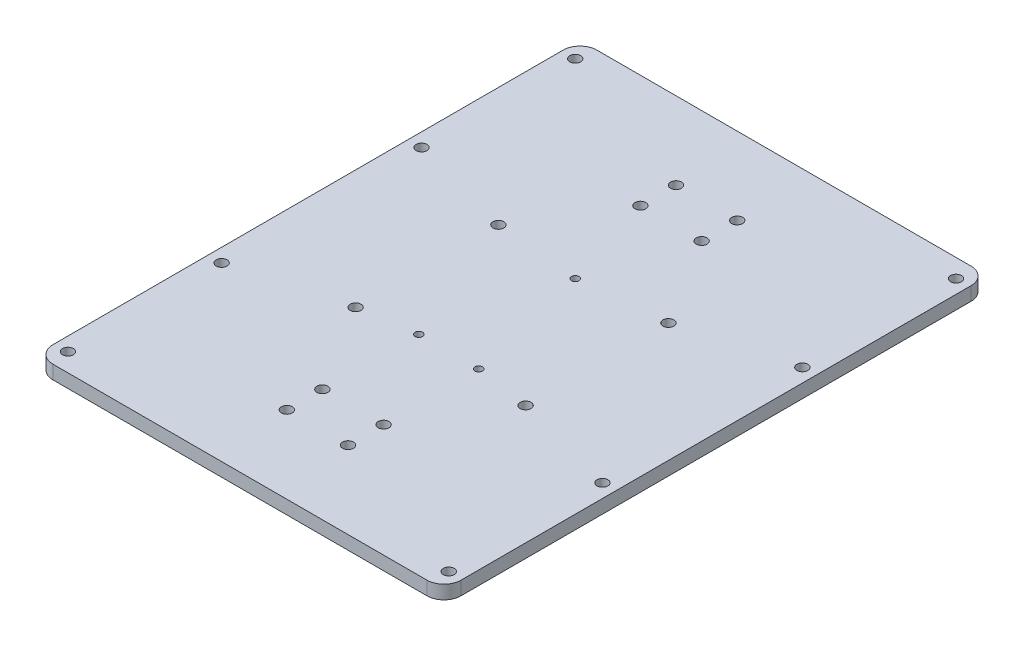
from build123d import *

# Parameters (mm, degrees)
SKETCH_1_W      = 120
SKETCH_1_H      = 160
SKETCH_1_R      = 1.6
SKETCH_1_R_2    = 1.1
EXTRUDE_1_DEPTH = 4
FILLET_1_R      = 5


with BuildPart() as part:
    # 草图1 → 凸台-拉伸1 (new body)
    with BuildSketch(Plane(origin=(0, 0, 0), x_dir=(1, 0, 0), z_dir=(0, 1, 0))):
        Rectangle(SKETCH_1_W, SKETCH_1_H)
        with Locations((-56, 74.6)):
            Circle(SKETCH_1_R, mode=Mode.SUBTRACT)
        with Locations((-56, 29.4)):
            Circle(SKETCH_1_R, mode=Mode.SUBTRACT)
        with Locations((-9, 57.23)):
            Circle(SKETCH_1_R, mode=Mode.SUBTRACT)
        with Locations((-9, 46.77)):
            Circle(SKETCH_1_R, mode=Mode.SUBTRACT)
        with Locations((-56, -29.4)):
            Circle(SKETCH_1_R, mode=Mode.SUBTRACT)
        with Locations((-9, -46.77)):
            Circle(SKETCH_1_R, mode=Mode.SUBTRACT)
        with Locations((-9, -57.23)):
            Circle(SKETCH_1_R, mode=Mode.SUBTRACT)
        with Locations((-56, -74.6)):
            Circle(SKETCH_1_R, mode=Mode.SUBTRACT)
        with Locations((56, -74.6)):
            Circle(SKETCH_1_R, mode=Mode.SUBTRACT)
        with Locations((9, -57.23)):
            Circle(SKETCH_1_R, mode=Mode.SUBTRACT)
        with Locations((9, -46.77)):
            Circle(SKETCH_1_R, mode=Mode.SUBTRACT)
        with Locations((56, -29.4)):
            Circle(SKETCH_1_R, mode=Mode.SUBTRACT)
        with Locations((56, 29.4)):
            Circle(SKETCH_1_R, mode=Mode.SUBTRACT)
        with Locations((9, 46.77)):
            Circle(SKETCH_1_R, mode=Mode.SUBTRACT)
        with Locations((9, 57.23)):
            Circle(SKETCH_1_R, mode=Mode.SUBTRACT)
        with Locations((56, 74.6)):
            Circle(SKETCH_1_R, mode=Mode.SUBTRACT)
        with Locations((0, 18.6)):
            Circle(SKETCH_1_R_2, mode=Mode.SUBTRACT)
        with Locations((8.8, -18.6)):
            Circle(SKETCH_1_R_2, mode=Mode.SUBTRACT)
        with Locations((-8.8, -18.6)):
            Circle(SKETCH_1_R_2, mode=Mode.SUBTRACT)
        with Locations((-25, 21)):
            Circle(SKETCH_1_R, mode=Mode.SUBTRACT)
        with Locations((25, 21)):
            Circle(SKETCH_1_R, mode=Mode.SUBTRACT)
        with Locations((25, -21)):
            Circle(SKETCH_1_R, mode=Mode.SUBTRACT)
        with Locations((-25, -21)):
            Circle(SKETCH_1_R, mode=Mode.SUBTRACT)
    extrude(amount=EXTRUDE_1_DEPTH)

    # 圆角1
    fillet_1_edges = [part.edges().sort_by_distance(p)[0] for p in [
        (-60, 2, -80),
        (60, 2, -80),
        (60, 2, 80),
        (-60, 2, 80),
    ]]
    fillet(fillet_1_edges, radius=FILLET_1_R)


solid = part.part
